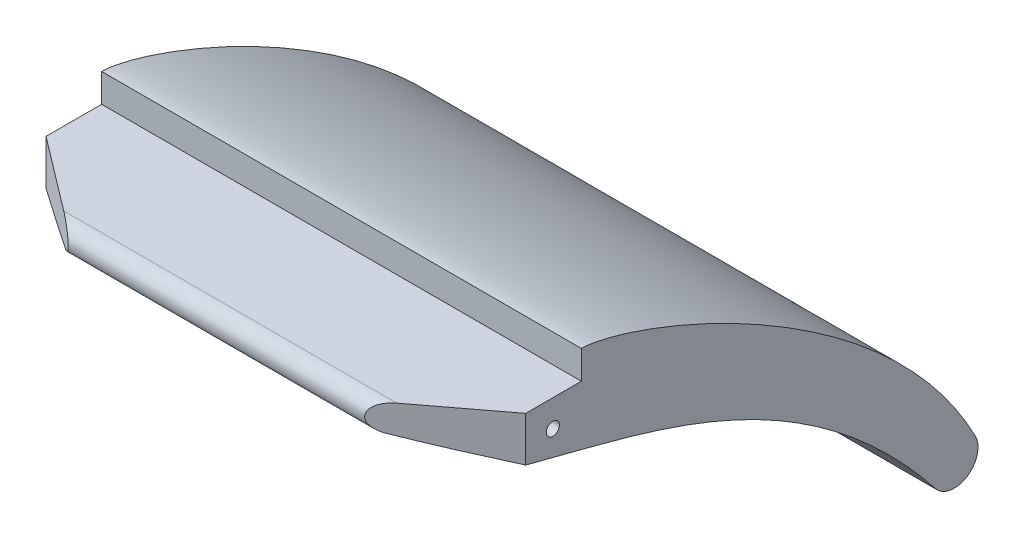
from build123d import *

# Parameters (mm, degrees)
SKETCH1_R           = 1.1303
BOSS_EXTRUDE1_DEPTH = 82.55
CUT_EXTRUDE1_DEPTH  = 121.310224488


with BuildPart() as part:
    # Sketch1 → Boss-Extrude1 (new body)
    with BuildSketch(Plane(origin=(0, 0, 0), x_dir=(0, 0, -1), z_dir=(1, 0, 0))):
        with BuildLine():
            Line((-14.235037061, 4.6355), (4.911613569, 4.6355))
            Line((4.911613569, 4.6355), (4.911613569, 9.525))
            add(Edge.make_bspline(
                [(4.911613569, 9.525), (13.356859809, 9.525), (56.914542054, -6.988883897), (72.701512247, -37.41793147)],
                knots=[0, 0, 0, 0, 1, 1, 1, 1], degree=3))
            ThreePointArc((72.701512247, -37.41793147), (71.292110965, -42.742171877), (65.857227597, -41.849988788))
            add(Edge.make_bspline(
                [(-15.004369583, 0), (9.374116417, -8.321172008), (39.423381365, -8.534365891), (65.857227597, -41.849988788)],
                knots=[0, 0, 0, 0, 1, 1, 1, 1], degree=3))
            ThreePointArc((-15.004369583, 0), (-16.584490869, 2.643836713), (-14.235037061, 4.6355))
        make_face()
        Circle(SKETCH1_R, mode=Mode.SUBTRACT)
    extrude(amount=BOSS_EXTRUDE1_DEPTH)

    # Sketch2 → Cut-Extrude1 (cut, through all)
    with BuildSketch(Plane(origin=(0, 4.6355, 0), x_dir=(1, 0, 0), z_dir=(0, 1, 0))):
        Polygon((0, -4.661711746), (0, -18.489908959), (18.236274836, -18.489908959), align=None)
        Polygon((82.55, -4.661711746), (82.55, -18.489908959), (64.313725164, -18.489908959), align=None)
    extrude(amount=-CUT_EXTRUDE1_DEPTH, mode=Mode.SUBTRACT)


solid = part.part
